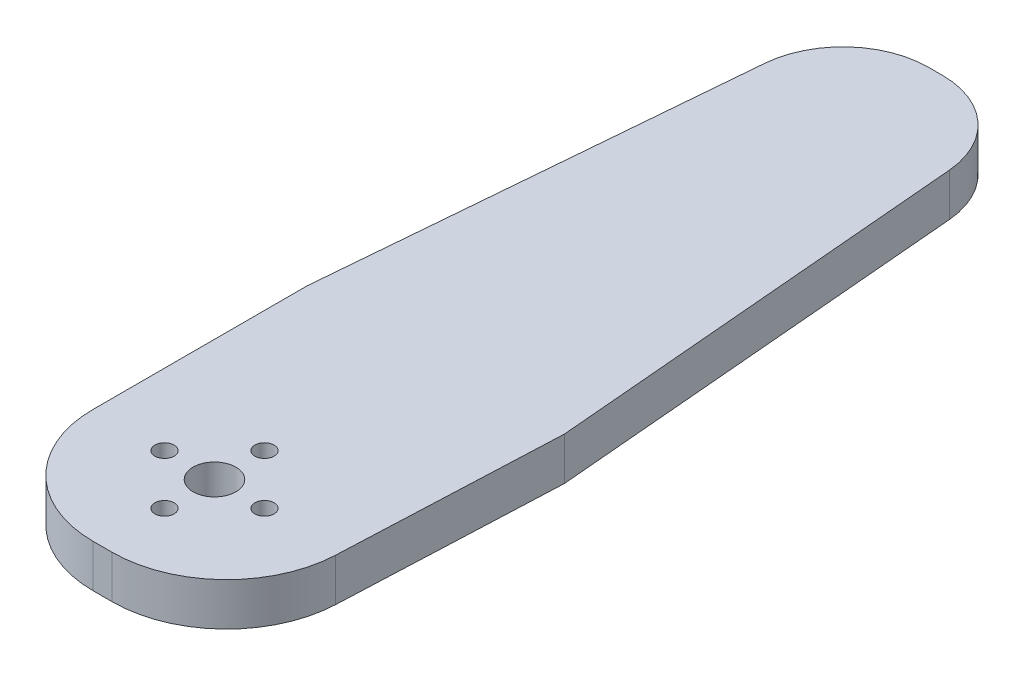
from build123d import *

# Parameters (mm, degrees)
BOSS_1_DEPTH = 6
S_CYL2_R     = 12.5
BOSS_2_DEPTH = 2
S_HOLE3_R    = 3
HOLE_3_DEPTH = 8.2
S_HOLE4_R    = 1.35
HOLE_4_DEPTH = 8.2
S_HOLE5_R    = 1.35
HOLE_5_DEPTH = 8.2
S_HOLE6_R    = 1.35
HOLE_6_DEPTH = 8.2
S_HOLE7_R    = 1.35
HOLE_7_DEPTH = 8.2


with BuildPart() as part:
    # S_prism1 → Boss_1 (new body)
    with BuildSketch(Plane(origin=(0, -6, 0), x_dir=(1, 0, 0), z_dir=(0, 1, 0))):
        with BuildLine():
            Line((-1, -16), (1.6805, -16))
            ThreePointArc((1.6805, -16), (12.745771818, -11.556826983), (17.6654, -0.695))
            Line((17.6654, -0.695), (19, 30))
            Line((19, 30), (13.9407, 89.0248))
            ThreePointArc((13.9407, 89.0248), (10.099439666, 96.840163588), (1.9846, 100))
            Line((1.9846, 100), (0.0154, 100))
            ThreePointArc((0.0154, 100), (-8.099439666, 96.840163588), (-11.9407, 89.0248))
            Line((-11.9407, 89.0248), (-17, 30))
            Line((-17, 30), (-17, 0))
            ThreePointArc((-17, 0), (-12.3137, -11.3137), (-1, -16))
        make_face()
    extrude(amount=BOSS_1_DEPTH)

    # S_cyl2 → Boss_2 (add)
    with BuildSketch(Plane(origin=(0, -8, 0), x_dir=(1, 0, 0), z_dir=(0, 1, 0))):
        Circle(S_CYL2_R)
    extrude(amount=BOSS_2_DEPTH)

    # S_hole3 → Hole_3 (cut)
    with BuildSketch(Plane(origin=(0, -8.1, 0), x_dir=(1, 0, 0), z_dir=(0, 1, 0))):
        Circle(S_HOLE3_R)
    extrude(amount=HOLE_3_DEPTH, mode=Mode.SUBTRACT)

    # S_hole4 → Hole_4 (cut)
    with BuildSketch(Plane(origin=(0, -8.1, 0), x_dir=(1, 0, 0), z_dir=(0, 1, 0))):
        with Locations((7, 0)):
            Circle(S_HOLE4_R)
    extrude(amount=HOLE_4_DEPTH, mode=Mode.SUBTRACT)

    # S_hole5 → Hole_5 (cut)
    with BuildSketch(Plane(origin=(0, -8.1, 0), x_dir=(1, 0, 0), z_dir=(0, 1, 0))):
        with Locations((0, -7)):
            Circle(S_HOLE5_R)
    extrude(amount=HOLE_5_DEPTH, mode=Mode.SUBTRACT)

    # S_hole6 → Hole_6 (cut)
    with BuildSketch(Plane(origin=(0, -8.1, 0), x_dir=(1, 0, 0), z_dir=(0, 1, 0))):
        with Locations((-7, 0)):
            Circle(S_HOLE6_R)
    extrude(amount=HOLE_6_DEPTH, mode=Mode.SUBTRACT)

    # S_hole7 → Hole_7 (cut)
    with BuildSketch(Plane(origin=(0, -8.1, 0), x_dir=(1, 0, 0), z_dir=(0, 1, 0))):
        with Locations((0, 7)):
            Circle(S_HOLE7_R)
    extrude(amount=HOLE_7_DEPTH, mode=Mode.SUBTRACT)


solid = part.part
